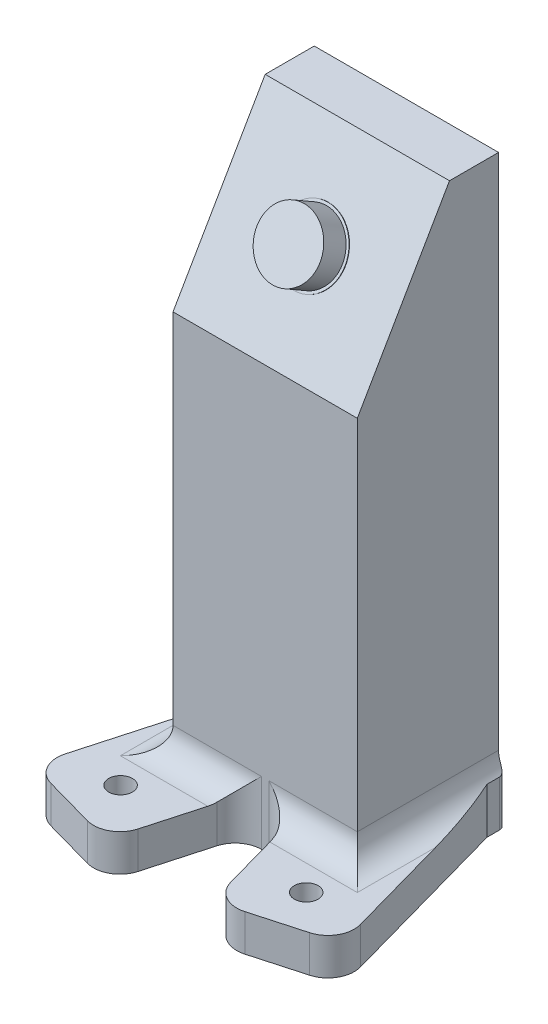
from build123d import *

# Parameters (mm, degrees)
AUFSATZ_LINEAR_AUSTRAGEN1_DEPTH = 35
SKIZZE3_R                       = 6
AUFSATZ_LINEAR_AUSTRAGEN2_DEPTH = 5
SKIZZE4_R                       = 6.5
AUFSATZ_LINEAR_AUSTRAGEN3_DEPTH = 0.1
SKIZZE9_R                       = 1.425
SCHNITT_LINEAR_AUSTRAGEN2_DEPTH = 10
SKIZZE10_R                      = 2.25
AUFSATZ_LINEAR_AUSTRAGEN4_DEPTH = 7
VERRUNDUNG1_R                   = 5
VERRUNDUNG2_R                   = 1


with BuildPart() as part:
    # Skizze1 → Aufsatz-Linear austragen1 (new body)
    with BuildSketch(Plane(origin=(0, 0, 0), x_dir=(0, 0, -1), z_dir=(1, 0, 0))):
        Polygon((0, 0), (17.5, 0), (26.82, 0), (26.82, 110.310889132), (17.5, 110.310889132), (0, 80), align=None)
    extrude(amount=AUFSATZ_LINEAR_AUSTRAGEN1_DEPTH)

    # Skizze3 → Aufsatz-Linear austragen2 (add)
    with BuildSketch(Plane(origin=(0, 20, 34.641016151), x_dir=(1, 0, 0), z_dir=(0, 0.4999999999999977, 0.86602540378444))):
        with Locations((17.5, 86.782032303)):
            Circle(SKIZZE3_R)
    extrude(amount=AUFSATZ_LINEAR_AUSTRAGEN2_DEPTH)

    # Skizze4 → Aufsatz-Linear austragen3 (add)
    with BuildSketch(Plane(origin=(0, 20, 34.641016151), x_dir=(1, 0, 0), z_dir=(0, 0.4999999999999977, 0.8660254037844399))):
        with Locations((17.5, 86.782032303)):
            Circle(SKIZZE4_R)
    extrude(amount=AUFSATZ_LINEAR_AUSTRAGEN3_DEPTH)

    # Skizze9 → Schnitt-Linear austragen2 (cut)
    with BuildSketch(Plane.XZ):
        with Locations((17.498844944, -21.644236877)):
            Circle(SKIZZE9_R)
    extrude(amount=-SCHNITT_LINEAR_AUSTRAGEN2_DEPTH, mode=Mode.SUBTRACT)

    # Skizze10 → Aufsatz-Linear austragen4 (add)
    # profile 1 of 2: a face of its own
    with BuildSketch(Plane.XZ):
        Polygon((35, -26.82), (36.222689888, -26.82), (36.222689888, -23.396698607), (46.889907729, 14.777378017), (27.627810102, 20.159904842), (21.994403466, 0), align=None)
        with Locations((35.124354886, 9.830031101)):
            Circle(SKIZZE10_R, mode=Mode.SUBTRACT)
    # profile 2 of 2: a face of its own
    with BuildSketch(Plane.XZ):
        Polygon((-1.222689888, -26.82), (-1.222689888, -23.396698607), (-11.889907729, 14.777378017), (7.372189898, 20.159904842), (13.005596534, 0), (0, -26.82), align=None)
        with Locations((-0.124354886, 9.830031101)):
            Circle(SKIZZE10_R, mode=Mode.SUBTRACT)
    extrude(amount=-AUFSATZ_LINEAR_AUSTRAGEN4_DEPTH)

    # Verrundung1
    verrundung1_edges = [part.edges().sort_by_distance(p)[0] for p in [
        (6.502798267, 7, 0),
        (28.497201733, 7, 0),
        (35, 7, -13.41),
        (0, 7, -13.41),
        (-11.889907729, 3.5, 14.777378017),
        (7.372189898, 3.5, 20.159904842),
        (46.889907729, 3.5, 14.777378017),
        (27.627810102, 3.5, 20.159904842),
        (21.994403466, 3.5, 0),
        (13.005596534, 3.5, 0),
    ]]
    fillet(verrundung1_edges, radius=VERRUNDUNG1_R)

    # Verrundung2
    verrundung2_edges = [part.edges().sort_by_distance(p)[0] for p in [
        (-1.222689888, 4.362018901, -26.82),
        (36.222689888, 4.362018901, -26.82),
    ]]
    fillet(verrundung2_edges, radius=VERRUNDUNG2_R)


solid = part.part
